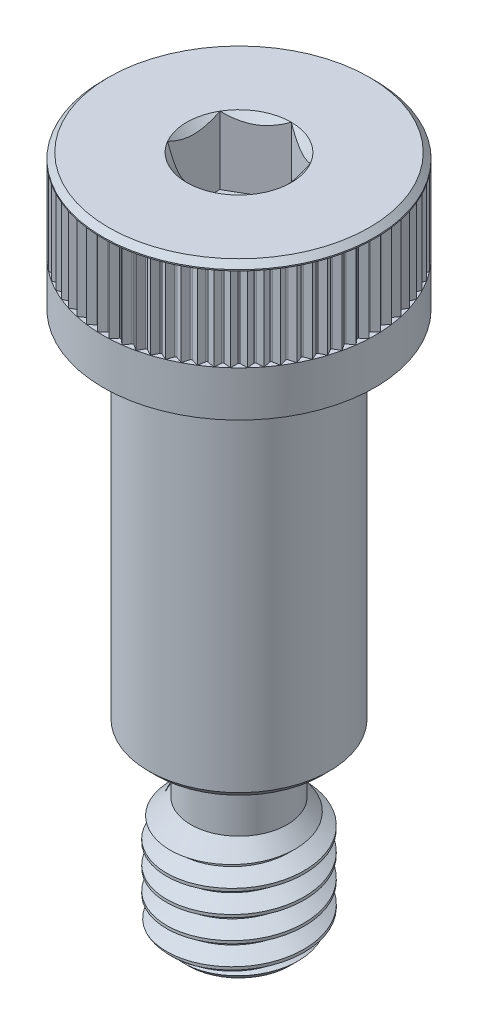
from build123d import *

# Parameters (mm, degrees)
SKETCH1_R          = 4.7625
EXTRUDE1_DEPTH     = 4.7625
CUT_EXTRUDE1_DEPTH = 2.38125
SKETCH4_R          = 3.175
EXTRUDE2_DEPTH     = 12.7
SKETCH5_R          = 2.413
EXTRUDE3_DEPTH     = 6.35
CHAMFER1_SIZE      = 0.635
CUT_SWEEP1_PITCH   = 0.79375
CUT_SWEEP1_TO      = 6.35
CUT_EXTRUDE3_DEPTH = 2.941919045
CHAMFER2_SIZE      = 0.194234129
CIRPATTERN2_COUNT  = 72
FILLET1_R          = 0.396875
CHAMFER3_SIZE      = 0.264583333


with BuildPart() as part:
    # Sketch1 → Extrude1 (new body)
    with BuildSketch(Plane(origin=(0, 0, 0), x_dir=(1, 0, 0), z_dir=(0, 1, 0))):
        with Locations(Location((0, 0, 0), (0, 0, 90))):
            Circle(SKETCH1_R)
    extrude(amount=EXTRUDE1_DEPTH)

    # Sketch2 → Cut-Extrude1 (cut)
    with BuildSketch(Plane(origin=(0, 4.7625, 0), x_dir=(-1, 0, 0), z_dir=(0, 1, 0))):
        Polygon((0, -1.833087105), (1.5875, -0.916543552), (1.5875, 0.916543552), (0, 1.833087105), (-1.5875, 0.916543552), (-1.5875, -0.916543552), align=None)
    extrude(amount=-CUT_EXTRUDE1_DEPTH, mode=Mode.SUBTRACT)

    # Sketch4 → Extrude2 (add)
    with BuildSketch(Plane.XZ):
        with Locations(Location((0, 0, 0), (0, 0, 90))):
            Circle(SKETCH4_R)
    extrude(amount=EXTRUDE2_DEPTH)

    # Sketch5 → Extrude3 (add)
    with BuildSketch(Plane.XZ.offset(12.7)):
        with Locations(Location((0, 0, 0), (0, 0, 270))):
            Circle(SKETCH5_R)
    extrude(amount=EXTRUDE3_DEPTH)

    # Chamfer1
    chamfer1_edges = [part.edges().sort_by_distance(p)[0] for p in [
        (0, -19.05, 2.413),
    ]]
    chamfer(chamfer1_edges, length=CHAMFER1_SIZE)

    # Cut-Sweep1: arcs per turn and ends read off the stored shape
    # Cut-Sweep1: the profile of Sketch13 profile screwed along a right-hand helix through 9 turns, 6 arcs to a turn; built about Z, then put on its axis
    cut_sweep1_z = Axis((0, 0, 0), (0, 0, 1))
    cut_sweep1_corners = [(2.4136, 0, -0.09887234), (2.4136, 0, -0.79409641), (1.897444252, 0, -0.49609375), (1.897444252, 0, -0.396875)]
    with BuildLine(mode=Mode.PRIVATE) as cut_sweep1_profile:
        Line(cut_sweep1_corners[0], cut_sweep1_corners[1])
        Line(cut_sweep1_corners[1], cut_sweep1_corners[2])
        Line(cut_sweep1_corners[2], cut_sweep1_corners[3])
        Line(cut_sweep1_corners[3], cut_sweep1_corners[0])
    cut_sweep1_cap = Face(cut_sweep1_profile.wire())
    cut_sweep1_turn_angles = [0, 30, 60, 90, 120, 150, 180, 210, 240, 270, 300, 330, 360]
    cut_sweep1_turn_weights = [1, 0.8660254037844387, 1, 0.8660254037844387, 1, 0.8660254037844387, 1, 0.8660254037844387, 1, 0.8660254037844387, 1, 0.8660254037844387, 1]
    cut_sweep1_turn_rails = [Edge.make_bspline([Vector(p[0], p[1], 0).rotate(cut_sweep1_z, cut_sweep1_turn_angles[k]) / cut_sweep1_turn_weights[k] + Vector(0, 0, p[2] + CUT_SWEEP1_PITCH * cut_sweep1_turn_angles[k] / 360) for k in range(13)], [0, 0, 0, 1, 1, 2, 2, 3, 3, 4, 4, 5, 5, 6, 6, 6], 2, cut_sweep1_turn_weights) for p in cut_sweep1_corners]
    cut_sweep1_turn_sides = [Face.make_surface_from_curves(cut_sweep1_turn_rails[p[0]], cut_sweep1_turn_rails[p[1]]) for p in [(0, 1), (1, 2), (2, 3), (3, 0)]]
    cut_sweep1 = Plane(origin=(0, -19.05, 0), x_dir=(0.7071067811865438, 0, 0.7071067811865512), z_dir=(0, 1, 0)) * split(Solid(Shell([*[p.moved(Location((0, 0, CUT_SWEEP1_PITCH * i))) for i in range(9) for p in cut_sweep1_turn_sides], cut_sweep1_cap, cut_sweep1_cap.rotate(cut_sweep1_z, 3240).moved(Location((0, 0, CUT_SWEEP1_PITCH * 3240 / 360)))])), bisect_by=Plane.XY.offset(CUT_SWEEP1_TO), keep=Keep.BOTTOM, mode=Mode.PRIVATE)
    add(cut_sweep1, mode=Mode.SUBTRACT)

    # Sketch18 → Cut-Revolve1 (revolve, cut)
    with BuildSketch(Plane.XY, mode=Mode.PRIVATE) as cut_revolve1_sk:
        Polygon((2.413, -12.7), (1.6891, -12.7), (1.6891, -14.8082), (2.413, -15.5321), align=None)
    revolve(cut_revolve1_sk.sketch.rotate(Axis((0, -12.7, 0), (0, 1, 0)), 87.5), axis=Axis((0, -12.7, 0), (0, 1, 0)), mode=Mode.SUBTRACT)

    # Sketch10 → Cut-Extrude3 (cut)
    with BuildSketch(Plane(origin=(0, 1.5875, 0), x_dir=(-1, 0, 0), z_dir=(0, 1, 0))):
        with BuildLine():
            Line((-4.757967155, -0.207737332), (-4.827695013, -0.210781716))
            Line((-4.827695013, -0.210781716), (-4.827695013, 0.210781716))
            Line((-4.827695013, 0.210781716), (-4.757967155, 0.207737332))
            Line((-4.757967155, 0.207737332), (-4.581019282, 0.030789459))
            ThreePointArc((-4.581019282, 0.030789459), (-4.568265871, 0), (-4.581019282, -0.030789459))
            Line((-4.581019282, -0.030789459), (-4.757967155, -0.207737332))
        make_face()
    cut_extrude3 = extrude(amount=CUT_EXTRUDE3_DEPTH, mode=Mode.SUBTRACT)

    # Chamfer2
    chamfer2_edges = [part.edges().sort_by_distance(p)[0] for p in [
        (0, 4.7625, 4.7625),
    ]]
    chamfer(chamfer2_edges, length=CHAMFER2_SIZE)

    # CirPattern2: Cut-Extrude3 ×72 about axis
    cirpattern2_axis = Axis((0, 0, 0), (0, 1, 0))
    for i in range(1, CIRPATTERN2_COUNT):
        add(cut_extrude3.rotate(cirpattern2_axis, i * 360 / CIRPATTERN2_COUNT), mode=Mode.SUBTRACT)

    # Fillet1
    fillet1_edges = [part.edges().sort_by_distance(p)[0] for p in [
        (-0.073677507, -12.7, 1.687492351),
    ]]
    fillet(fillet1_edges, radius=FILLET1_R)

    # Chamfer3
    chamfer3_edges = [part.edges().sort_by_distance(p)[0] for p in [
        (0, -12.7, -3.175),
    ]]
    chamfer(chamfer3_edges, length=CHAMFER3_SIZE)

    # Extrude4 cone 1 section (through the dimple's axis) → Extrude4 (revolve, cut)
    with BuildSketch(Plane(origin=(0, 4.7625, 0), x_dir=(0, 0, 1), z_dir=(1, 0, 0))):
        Polygon((0, 0), (1.833087105, 0), (0, 1.833087105), align=None)
    revolve(axis=Axis((0, 4.7625, 0), (0, -1, 0)), mode=Mode.SUBTRACT)


solid = part.part
